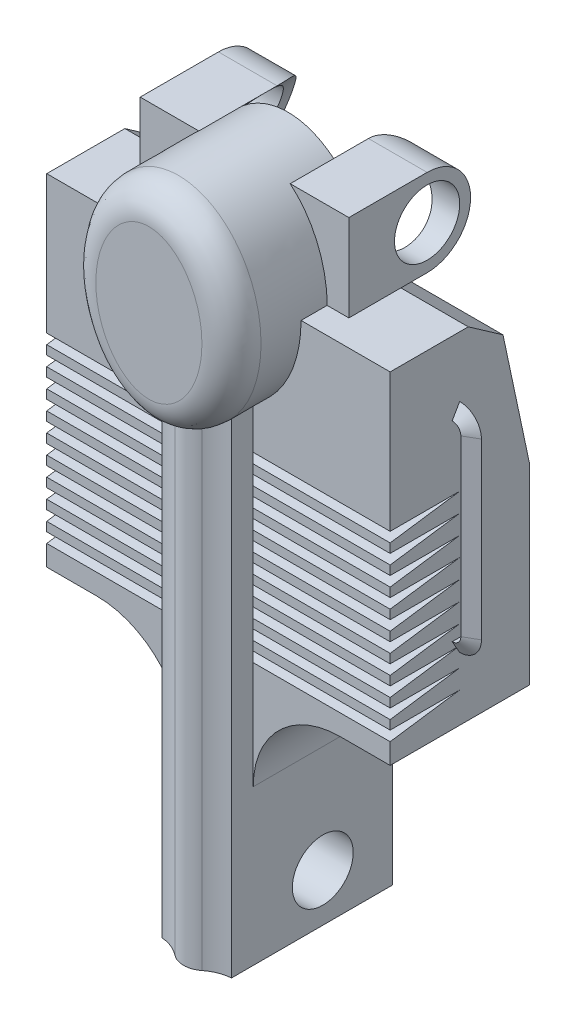
from build123d import *
from OCP.BRepAlgoAPI import BRepAlgoAPI_Cut
from OCP.TopTools import TopTools_ListOfShape

# Parameters (mm, degrees)
BOSS_EXTRUDE1_DEPTH            = 8
CUT_EXTRUDE1_REACH             = 53.969
SKETCH3_R                      = 3.5
CUT_EXTRUDE1_DIRECTION_2_REACH = 53.969
SKETCH6_RX                     = 12
SKETCH6_RY                     = 9.5
BOSS_EXTRUDE5_DEPTH            = 16
BOSS_EXTRUDE8_START            = -2.4999999
BOSS_EXTRUDE8_DEPTH            = 2.4999999
BOSS_EXTRUDE8_START_2          = -9.0000001
BOSS_EXTRUDE8_2_DEPTH          = 14.0000001
BOSS_EXTRUDE8_START_3          = 4
BOSS_EXTRUDE8_3_DEPTH          = 5.500000005
CUT_EXTRUDE2_REACH             = 61.252
SKETCH8_R                      = 3.75
MIRROR1_START                  = -12
MIRROR1_OUTLINE_R              = 3.75
MIRROR1_DEPTH                  = 2.4999999
MIRROR1_START_2                = -9.0000001
MIRROR1_2_DEPTH                = 14.0000001
MIRROR1_START_3                = -9.500000095
MIRROR1_3_OUTLINE_R            = 3.75
MIRROR1_3_DEPTH                = 5.500000095
CHAMFER1_SIZE                  = 17
CHAMFER1_SIZE2                 = 3.613461548
BOSS_EXTRUDE9_REACH            = 84.988
CUT_EXTRUDE3_REACH             = 57.379
CUT_EXTRUDE3_DIRECTION_2_REACH = 57.379
LPATTERN1_COUNT                = 10
LPATTERN1_PITCH                = 2.2
FILLET1_R                      = 3.4
CUT_EXTRUDE4_START             = -42
CUT_EXTRUDE4_DEPTH             = 44.5


with BuildPart() as part:
    # Sketch2 → Boss-Extrude1 (new, symmetric)
    with BuildSketch(Plane.XY):
        with BuildLine():
            Line((-19.75, -19.6), (-19.75, 19.6))
            Line((-19.75, 19.6), (19.75, 19.6))
            Line((19.75, 19.6), (19.75, -19.6))
            Line((19.75, -19.6), (14, -19.6))
            ThreePointArc((14, -19.6), (6.928932188, -22.528932188), (4, -29.6))
            Line((4, -29.6), (4, -47.4))
            Line((4, -47.4), (-4, -47.4))
            Line((-4, -47.4), (-4, -29.6))
            ThreePointArc((-4, -29.6), (-6.928932188, -22.528932188), (-14, -19.6))
            Line((-14, -19.6), (-19.75, -19.6))
        make_face()
    extrude(amount=BOSS_EXTRUDE1_DEPTH, both=True)

    # Sketch3 → Cut-Extrude1 (cut, up to next)
    with BuildSketch(Plane(origin=(0, 0, 0), x_dir=(0, 0, -1), z_dir=(1, 0, 0)), mode=Mode.PRIVATE) as cut_extrude1_sk1:
        with Locations(Location((0, -41.9, 0), (0, 0, 180))):
            Circle(SKETCH3_R)
    cut_extrude1_tool1 = extrude(cut_extrude1_sk1.sketch, amount=-CUT_EXTRUDE1_REACH, mode=Mode.PRIVATE) & part.part
    add(cut_extrude1_tool1.solids().sort_by_distance((0, -41.9, 0))[0], mode=Mode.SUBTRACT)

    # Sketch3 → Cut-Extrude1 direction 2 (cut, up to next)
    with BuildSketch(Plane(origin=(0, 0, 0), x_dir=(0, 0, -1), z_dir=(1, 0, 0)), mode=Mode.PRIVATE) as cut_extrude1_direction_2_sk1:
        with Locations(Location((0, -41.9, 0), (0, 0, 180))):
            Circle(SKETCH3_R)
    cut_extrude1_direction_2_tool1 = extrude(cut_extrude1_direction_2_sk1.sketch, amount=CUT_EXTRUDE1_DIRECTION_2_REACH, mode=Mode.PRIVATE) & part.part
    add(cut_extrude1_direction_2_tool1.solids().sort_by_distance((0, -41.9, 0))[0], mode=Mode.SUBTRACT)

    # Sketch6 → Boss-Extrude5 (add)
    with BuildSketch(Plane(origin=(0, 0, 16), x_dir=(-1, 0, 0), z_dir=(0, 0, -1))):
        with Locations(Location((0, 19.6), (0, 0, 90))):
            Ellipse(SKETCH6_RX, SKETCH6_RY)
    extrude(amount=BOSS_EXTRUDE5_DEPTH)


with BuildPart() as boss_extrude8_tool:
    # Boss-Extrude8: read off the stored shape, not the designer's step
    # Boss-Extrude8 outline → Boss-Extrude8 (new body)
    with BuildSketch(Plane(origin=(12, 0, 0), x_dir=(0, 0, -1), z_dir=(1, 0, 0)).offset(BOSS_EXTRUDE8_START)):
        with BuildLine():
            Line((-5, 29.6), (-5, 19.6))
            Line((-5, 19.6), (4, 19.6))
            ThreePointArc((4, 19.6), (9, 24.6), (4, 29.6))
            Line((4, 29.6), (-5, 29.6))
        make_face()
    extrude(amount=BOSS_EXTRUDE8_DEPTH)


with BuildPart() as part_1:
    add(part.part)


with BuildPart() as part_2:
    # Boss-Extrude8: joined with boss_extrude8_tool
    add(part_1.part.fuse(boss_extrude8_tool.part, tol=0.00001))


with BuildPart() as boss_extrude8_2_tool:
    # Boss-Extrude8 2 outline → Boss-Extrude8 2 (new body)
    with BuildSketch(Plane.XY.offset(BOSS_EXTRUDE8_START_2)):
        with BuildLine():
            Line((9.5000001, 29.6), (5.251320895, 29.600001416))
            add(Edge.make_bspline(
                [(5.251320895, 29.600001416), (9.500000798, 26.040101483), (9.5, 19.599998121)],
                knots=[3.727277984, 3.727277984, 3.727277984, 4.712389137, 4.712389137, 4.712389137], degree=2, weights=[1, 0.881127258, 1]))
            Line((9.5, 19.599998121), (9.5000001, 29.6))
        make_face()
    extrude(amount=BOSS_EXTRUDE8_2_DEPTH)


with BuildPart() as part_3:
    add(part_2.part)


with BuildPart() as part_4:
    # Boss-Extrude8 2: joined with boss_extrude8_2_tool
    add(part_3.part.fuse(boss_extrude8_2_tool.part, tol=0.00001))


with BuildPart() as boss_extrude8_3_tool:
    # Boss-Extrude8 3 outline → Boss-Extrude8 3 (new body)
    with BuildSketch(Plane.YZ.offset(BOSS_EXTRUDE8_START_3)):
        with BuildLine():
            Line((19.599998121, -8), (19.599998121, -9.0000001))
            Line((19.599998121, -9.0000001), (24.6, -9))
            ThreePointArc((24.6, -9), (21.064466094, -7.535533906), (19.6, -4))
            Line((19.6, -4), (19.599998121, -8))
        make_face()
        with BuildLine():
            ThreePointArc((29.6, -4), (28.135533906, -7.535533906), (24.6, -9))
            Line((24.6, -9), (29.6, -9.0000001))
            Line((29.6, -9.0000001), (29.6, -4))
        make_face()
    extrude(amount=BOSS_EXTRUDE8_3_DEPTH)


with BuildPart() as part_5:
    add(part_4.part)

    # Boss-Extrude8 3: cut by boss_extrude8_3_tool, with a tolerance
    boss_extrude8_3_stock = TopTools_ListOfShape()
    boss_extrude8_3_stock.Append(part_5.part.wrapped)
    boss_extrude8_3_tools = TopTools_ListOfShape()
    boss_extrude8_3_tools.Append(boss_extrude8_3_tool.part.wrapped)
    boss_extrude8_3_cut = BRepAlgoAPI_Cut()
    boss_extrude8_3_cut.SetArguments(boss_extrude8_3_stock)
    boss_extrude8_3_cut.SetTools(boss_extrude8_3_tools)
    boss_extrude8_3_cut.SetFuzzyValue(0.00001)
    boss_extrude8_3_cut.Build()
    add(Compound.cast(boss_extrude8_3_cut.Shape()).solids(), mode=Mode.REPLACE)

    # Sketch8 → Cut-Extrude2 (cut, up to next)
    with BuildSketch(Plane(origin=(12, 0, 0), x_dir=(0, 0, -1), z_dir=(1, 0, 0)), mode=Mode.PRIVATE) as cut_extrude2_sk1:
        with Locations((4, 24.6)):
            Circle(SKETCH8_R)
    cut_extrude2_tool1 = extrude(cut_extrude2_sk1.sketch, amount=-CUT_EXTRUDE2_REACH, mode=Mode.PRIVATE) & part_5.part
    add(cut_extrude2_tool1.solids().sort_by_distance((12, 24.6, -4))[0], mode=Mode.SUBTRACT)


with BuildPart() as mirror1_tool:
    # Mirror1: read off the stored shape, not the designer's step
    # Mirror1 outline → Mirror1 (new body)
    with BuildSketch(Plane.YZ.offset(MIRROR1_START)):
        with BuildLine():
            Line((29.6, -4), (29.6, 5))
            Line((29.6, 5), (19.6, 5))
            Line((19.6, 5), (19.6, -4))
            ThreePointArc((19.6, -4), (24.6, -9), (29.6, -4))
        make_face()
        with Locations((24.6, -4)):
            Circle(MIRROR1_OUTLINE_R, mode=Mode.SUBTRACT)
    extrude(amount=MIRROR1_DEPTH)


with BuildPart() as part_6:
    add(part_5.part)


with BuildPart() as part_7:
    # Mirror1: joined with mirror1_tool
    add(part_6.part.fuse(mirror1_tool.part, tol=0.00001))


with BuildPart() as mirror1_2_tool:
    # Mirror1 2 outline → Mirror1 2 (new body)
    with BuildSketch(Plane.XY.offset(MIRROR1_START_2)):
        with BuildLine():
            Line((-9.5000001, 29.6), (-9.5, 19.599998121))
            add(Edge.make_bspline(
                [(-9.5, 19.599998121), (-9.500000798, 26.040101483), (-5.251320895, 29.600001416)],
                knots=[1.57079617, 1.57079617, 1.57079617, 2.555907324, 2.555907324, 2.555907324], degree=2, weights=[1, 0.881127258, 1]))
            Line((-5.251320895, 29.600001416), (-9.5000001, 29.6))
        make_face()
    extrude(amount=MIRROR1_2_DEPTH)


with BuildPart() as part_8:
    add(part_7.part)


with BuildPart() as part_9:
    # Mirror1 2: joined with mirror1_2_tool
    add(part_8.part.fuse(mirror1_2_tool.part, tol=0.00001))


with BuildPart() as mirror1_3_tool:
    # Mirror1 3 outline → Mirror1 3 (new body)
    with BuildSketch(Plane.YZ.offset(MIRROR1_START_3)):
        with BuildLine():
            Line((19.599998121, -9.0000001), (24.6, -9))
            ThreePointArc((24.6, -9), (21.064466094, -7.535533906), (19.6, -4))
            add(Edge.make_bspline(
                [(19.6, -4), (19.6, -5), (19.6, -6), (19.6, -7), (19.6, -8)],
                knots=[0.692307707, 0.692307707, 0.692307707, 0.692307707, 0.692307707, 1, 1, 1, 1, 1], degree=4))
            Line((19.6, -8), (19.599998121, -9.0000001))
        make_face()
        with BuildLine():
            ThreePointArc((29.6, -4), (28.135533906, -7.535533906), (24.6, -9))
            Line((24.6, -9), (29.6, -9.0000001))
            Line((29.6, -9.0000001), (29.6, -4))
        make_face()
        with Locations((24.6, -4)):
            Circle(MIRROR1_3_OUTLINE_R)
    extrude(amount=MIRROR1_3_DEPTH)


with BuildPart() as part_10:
    add(part_9.part)

    # Mirror1 3: cut by mirror1_3_tool, with a tolerance
    mirror1_3_stock = TopTools_ListOfShape()
    mirror1_3_stock.Append(part_10.part.wrapped)
    mirror1_3_tools = TopTools_ListOfShape()
    mirror1_3_tools.Append(mirror1_3_tool.part.wrapped)
    mirror1_3_cut = BRepAlgoAPI_Cut()
    mirror1_3_cut.SetArguments(mirror1_3_stock)
    mirror1_3_cut.SetTools(mirror1_3_tools)
    mirror1_3_cut.SetFuzzyValue(0.00001)
    mirror1_3_cut.Build()
    add(Compound.cast(mirror1_3_cut.Shape()).solids(), mode=Mode.REPLACE)

    # Chamfer1
    chamfer1_edges = [part_10.edges().sort_by_distance(p)[0] for p in [
        (0, 19.6, -8),
    ]]
    chamfer1_side = [part_10.faces().sort_by_distance(p)[0] for p in [
        (0, -4.624477781, -8),
    ]]
    chamfer(chamfer1_edges, length=CHAMFER1_SIZE, length2=CHAMFER1_SIZE2, reference=chamfer1_side[0])

    # Sketch9 → Boss-Extrude9 (add, up to next)
    with BuildSketch(Plane.XZ.offset(47.4), mode=Mode.PRIVATE) as boss_extrude9_sk1:
        with BuildLine():
            Line((-4, 8), (-4, 10.5))
            ThreePointArc((-4, 10.5), (-2.704641052, 10.797044129), (-1.552536302, 11.459497647))
            ThreePointArc((-1.552536302, 11.459497647), (0, 12), (1.552536302, 11.459497647))
            ThreePointArc((1.552536302, 11.459497647), (2.704641052, 10.797044129), (4, 10.5))
            Line((4, 10.5), (4, 8))
            Line((4, 8), (-4, 8))
        make_face()
    boss_extrude9_tool1 = extrude(boss_extrude9_sk1.sketch, amount=-BOSS_EXTRUDE9_REACH, mode=Mode.PRIVATE) - part_10.part
    add(boss_extrude9_tool1.solids().sort_by_distance((0, -47.4, 9.65635))[0])

    # Cut-Extrude3: up to this face of the body (flat: up to its plane)
    cut_extrude3_end = Plane(part_10.part.faces().sort_by_distance((-19.75, -0.717459588, 0.349916686))[0])
    # Sketch10 → Cut-Extrude3 (cut, up to the picked face)
    with BuildSketch(Plane.ZY.offset(4), mode=Mode.PRIVATE) as cut_extrude3_sk1:
        Polygon((8, 3.715565512), (0, 3.715565512), (8, 2.565565512), align=None)
    cut_extrude3_tool1 = split(extrude(cut_extrude3_sk1.sketch, amount=CUT_EXTRUDE3_REACH, mode=Mode.PRIVATE), bisect_by=cut_extrude3_end, keep=Keep.BOTH, mode=Mode.PRIVATE)
    cut_extrude3 = cut_extrude3_tool1.solids().sort_by(Axis((-4, 3.332232, 5.333333), (-1, 0, 0)))[0]
    add(cut_extrude3, mode=Mode.SUBTRACT)

    # Cut-Extrude3 direction 2: up to this face of the body (flat: up to its plane)
    cut_extrude3_direction_2_end = Plane(part_10.part.faces().sort_by_distance((19.75, -0.717459588, 0.349916686))[0])
    # Sketch10 → Cut-Extrude3 direction 2 (cut, up to the picked face)
    with BuildSketch(Plane.ZY.offset(4), mode=Mode.PRIVATE) as cut_extrude3_direction_2_sk1:
        Polygon((8, 3.715565512), (0, 3.715565512), (8, 2.565565512), align=None)
    cut_extrude3_direction_2_tool1 = split(extrude(cut_extrude3_direction_2_sk1.sketch, amount=-CUT_EXTRUDE3_DIRECTION_2_REACH, mode=Mode.PRIVATE), bisect_by=cut_extrude3_direction_2_end, keep=Keep.BOTH, mode=Mode.PRIVATE)
    cut_extrude3_direction_2 = cut_extrude3_direction_2_tool1.solids().sort_by(Axis((-4, 3.332232, 5.333333), (1, 0, 0)))[0]
    add(cut_extrude3_direction_2, mode=Mode.SUBTRACT)

    # LPattern1: Cut-Extrude3, Cut-Extrude3 direction 2 ×10
    with Locations(*[(0, -i * LPATTERN1_PITCH, 0) for i in range(1, LPATTERN1_COUNT)]):
        add(cut_extrude3, mode=Mode.SUBTRACT)
        add(cut_extrude3_direction_2, mode=Mode.SUBTRACT)

    # Fillet1
    fillet1_edges = [part_10.edges().sort_by_distance(p)[0] for p in [
        (-0.001717011, 7.600000196, 16),
    ]]
    fillet(fillet1_edges, radius=FILLET1_R)

    # Sweep1: sweep along a path in Sketch11
    with BuildLine(Plane.XY) as sweep1_path:
        ThreePointArc((-19.75, 11.657782756), (-20.810660172, 11.218442928), (-21.25, 10.157782756))
        Line((-21.25, 10.157782756), (-21.25, -9.842217244))
        ThreePointArc((-21.25, -9.842217244), (-20.810660172, -10.902877416), (-19.75, -11.342217244))
    # Sketch12 → Sweep1 (sweep)
    with BuildSketch(Plane.ZY.offset(19.75)):
        Polygon((-0.866025404, -10.842217244), (0.866025404, -10.842217244), (0, -12.342217244), align=None)
    sweep1 = sweep(path=sweep1_path.line)

    # Mirror4: Sweep1 across plane
    add(sweep1.mirror(Plane(origin=(0, 0, 0), x_dir=(0, 0, 1), z_dir=(1, 0, 0))))

    # Sketch13 → Cut-Extrude4 (cut)
    with BuildSketch(Plane(origin=(19.75, 0, 0), x_dir=(0, 0, -1), z_dir=(1, 0, 0)).offset(CUT_EXTRUDE4_START)):
        Polygon((4.981696824, 16.8), (0.982882405, 19.6), (4.386538452, 19.6), align=None)
    extrude(amount=CUT_EXTRUDE4_DEPTH, mode=Mode.SUBTRACT)


solid = part_10.part
